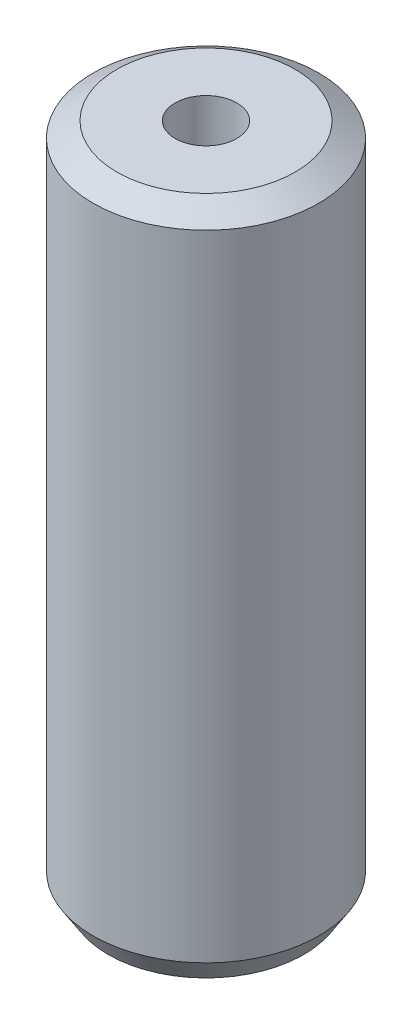
from build123d import *
from OCP.BRepFilletAPI import BRepFilletAPI_MakeChamfer

# Parameters (mm, degrees)
SKETCH1_R           = 15
BOSS_EXTRUDE1_DEPTH = 89.494689469
SKETCH2_R           = 4.100307333
CUT_EXTRUDE1_DEPTH  = 92.974449947
CHAMFER1_SIZE       = 2.004139752
CHAMFER1_SIZE2      = 3.154608719


with BuildPart() as part:
    # Sketch1 → Boss-Extrude1 (new body)
    with BuildSketch(Plane(origin=(0, 0, 0), x_dir=(1, 0, 0), z_dir=(0, 1, 0))):
        Circle(SKETCH1_R)
    extrude(amount=BOSS_EXTRUDE1_DEPTH)

    # Sketch2 → Cut-Extrude1 (cut, through all)
    with BuildSketch(Plane(origin=(0, 0, 0), x_dir=(1, 0, 0), z_dir=(0, 1, 0))):
        Circle(SKETCH2_R)
    extrude(amount=CUT_EXTRUDE1_DEPTH, mode=Mode.SUBTRACT)

    # Chamfer1: one chamfer whose edges measure the first distance from different faces: ONE call of the kernel's chamfer builder (chamfer() names one face for all edges)
    chamfer1_edges_1 = [part.edges().sort_by_distance(p)[0] for p in [
        (-15, 89.494689469, 0),
    ]]
    chamfer1_side_1 = [part.faces().sort_by_distance(p)[0] for p in [
        (-15, 44.747344734, 0),
    ]]
    chamfer1_edges_2 = [part.edges().sort_by_distance(p)[0] for p in [
        (-15, 0, 0),
    ]]
    chamfer1_side_2 = [part.faces().sort_by_distance(p)[0] for p in [
        (-14.575735931, 0, 0),
    ]]
    chamfer1 = BRepFilletAPI_MakeChamfer(part.part.solid().wrapped)
    for e in chamfer1_edges_1:
        chamfer1.Add(CHAMFER1_SIZE, CHAMFER1_SIZE2, e.wrapped, chamfer1_side_1[0].wrapped)  # the first distance lies on this face
    for e in chamfer1_edges_2:
        chamfer1.Add(CHAMFER1_SIZE, CHAMFER1_SIZE2, e.wrapped, chamfer1_side_2[0].wrapped)  # the first distance lies on this face
    add(Compound.cast(chamfer1.Shape()), mode=Mode.REPLACE)


solid = part.part
